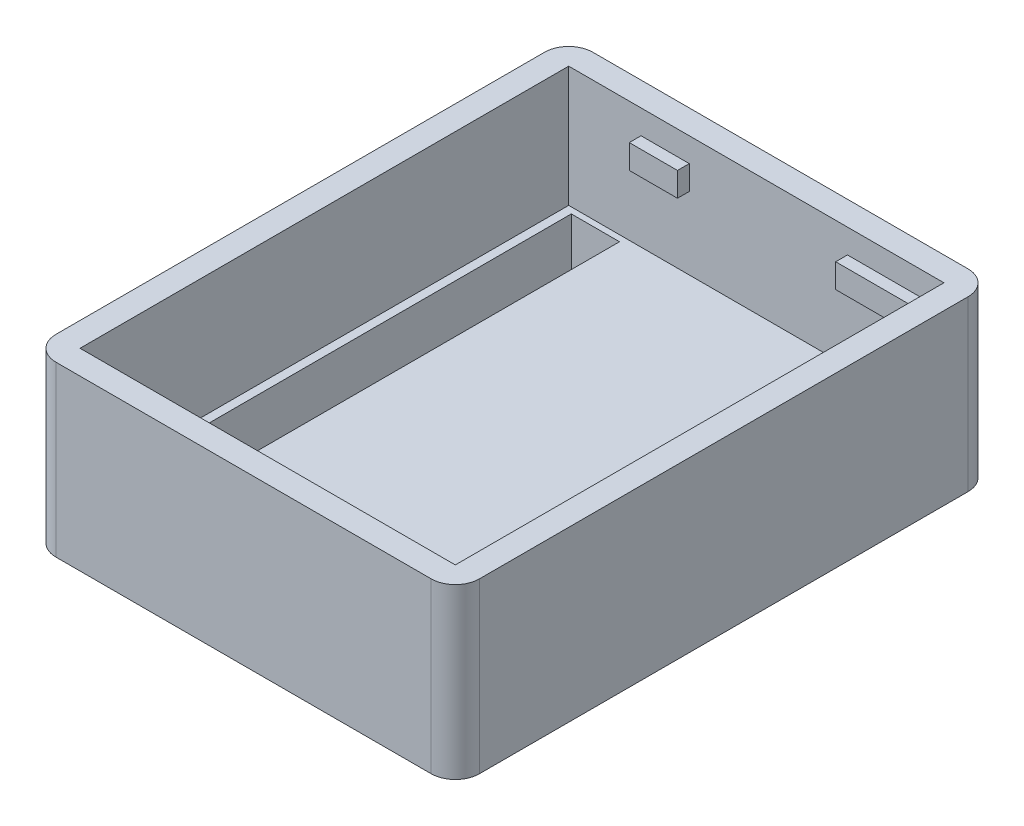
from build123d import *

# Parameters (mm, degrees)
BOSS_EXTRU_1_DEPTH      = 7
ESQUISSE2_W             = 15.56012
ESQUISSE2_H             = 20.26185
ENL_V_MAT_EXTRU_1_DEPTH = 5
ESQUISSE5_W             = 2
ESQUISSE5_H             = 19.76
ENL_V_MAT_EXTRU_3_DEPTH = 29.791453243
ESQUISSE6_W             = 3
ESQUISSE6_H             = 1
BOSS_EXTRU_2_DEPTH      = 0.48904
ESQUISSE7_W             = 3
ESQUISSE7_H             = 1
BOSS_EXTRU_3_DEPTH      = 0.48904
ESQUISSE8_W             = 3
ESQUISSE8_H             = 1
BOSS_EXTRU_4_DEPTH      = 0.48904
ESQUISSE9_W             = 3
ESQUISSE9_H             = 1
BOSS_EXTRU_5_DEPTH      = 0.48904
ESQUISSE10_W            = 2
ESQUISSE10_H            = 1
BOSS_EXTRU_6_DEPTH      = 0.48904
ESQUISSE11_W            = 2
ESQUISSE11_H            = 1
BOSS_EXTRU_7_DEPTH      = 0.48904


with BuildPart() as part:
    # Esquisse1 → Boss.-Extru.1 (new body)
    with BuildSketch(Plane(origin=(0, 0, 0), x_dir=(1, 0, 0), z_dir=(0, 1, 0))):
        with BuildLine():
            Line((1, 0), (16.56012, 0))
            ThreePointArc((16.56012, 0), (17.267226781, 0.292893219), (17.56012, 1))
            Line((17.56012, 1), (17.56012, 21.26185))
            ThreePointArc((17.56012, 21.26185), (17.267226781, 21.968956781), (16.56012, 22.26185))
            Line((16.56012, 22.26185), (1, 22.26185))
            ThreePointArc((1, 22.26185), (0.292893219, 21.968956781), (0, 21.26185))
            Line((0, 21.26185), (0, 1))
            ThreePointArc((0, 1), (0.292893219, 0.292893219), (1, 0))
        make_face()
    extrude(amount=BOSS_EXTRU_1_DEPTH)

    # Esquisse2 → Enlèv. mat.-Extru.1 (cut)
    with BuildSketch(Plane(origin=(0, 7, 0), x_dir=(1, 0, 0), z_dir=(0, 1, 0))):
        with Locations((8.78006, 11.130925)):
            Rectangle(ESQUISSE2_W, ESQUISSE2_H)
    extrude(amount=-ENL_V_MAT_EXTRU_1_DEPTH, mode=Mode.SUBTRACT)

    # Esquisse5 → Enlèv. mat.-Extru.3 (cut, through all)
    with BuildSketch(Plane(origin=(0, 2, 0), x_dir=(1, 0, 0), z_dir=(0, 1, 0))):
        with Locations((2.36, 11.13)):
            Rectangle(ESQUISSE5_W, ESQUISSE5_H)
    extrude(amount=-ENL_V_MAT_EXTRU_3_DEPTH, mode=Mode.SUBTRACT)

    # Esquisse6 → Boss.-Extru.2 (add)
    with BuildSketch(Plane.XY.offset(-21.26185)):
        with Locations((14.06012, 5.5)):
            Rectangle(ESQUISSE6_W, ESQUISSE6_H)
    extrude(amount=BOSS_EXTRU_2_DEPTH)

    # Esquisse7 → Boss.-Extru.3 (add)
    with BuildSketch(Plane.ZY.offset(-16.56012)):
        with Locations((-18.76185, 5.5)):
            Rectangle(ESQUISSE7_W, ESQUISSE7_H)
    extrude(amount=BOSS_EXTRU_3_DEPTH)

    # Esquisse8 → Boss.-Extru.4 (add)
    with BuildSketch(Plane(origin=(0, 0, -1), x_dir=(-1, 0, 0), z_dir=(0, 0, -1))):
        with Locations((-14.06012, 5.5)):
            Rectangle(ESQUISSE8_W, ESQUISSE8_H)
    extrude(amount=BOSS_EXTRU_4_DEPTH)

    # Esquisse9 → Boss.-Extru.5 (add)
    with BuildSketch(Plane.ZY.offset(-16.56012)):
        with Locations((-3.5, 5.5)):
            Rectangle(ESQUISSE9_W, ESQUISSE9_H)
    extrude(amount=BOSS_EXTRU_5_DEPTH)

    # Esquisse10 → Boss.-Extru.6 (add)
    with BuildSketch(Plane.XY.offset(-21.26185)):
        with Locations((5, 5.5)):
            Rectangle(ESQUISSE10_W, ESQUISSE10_H)
    extrude(amount=BOSS_EXTRU_6_DEPTH)

    # Esquisse11 → Boss.-Extru.7 (add)
    with BuildSketch(Plane(origin=(0, 0, -1), x_dir=(-1, 0, 0), z_dir=(0, 0, -1))):
        with Locations((-5, 5.5)):
            Rectangle(ESQUISSE11_W, ESQUISSE11_H)
    extrude(amount=BOSS_EXTRU_7_DEPTH)


solid = part.part
